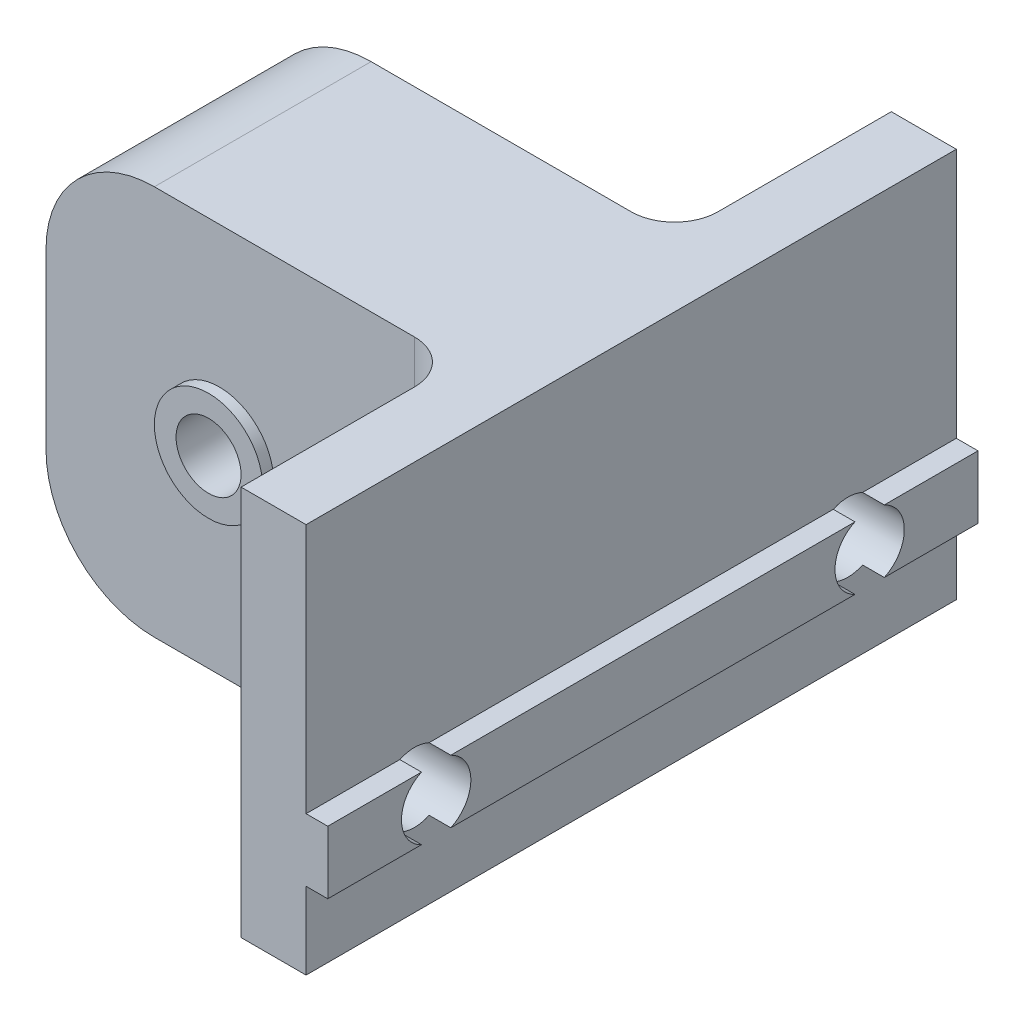
from build123d import *
from build123d.topology import SkipClean

# Parameters (mm, degrees)
MAIN_EXTRUSION_DEPTH            = 30
ESQUISSE2_W                     = 19
ESQUISSE2_H                     = 10
EXTERNAL_HOLE_DEPTH             = 37.986484018
ESQUISSE3_R                     = 1.6
MAKERBEAMFIXINGHOLE_DEPTH       = 38.815340802
ESQUISSE4_R                     = 1.5
HOLELINKWITHCODERSSUPPORT_DEPTH = 27.702059846
CONG_2_R                        = 2
CONG_3_R                        = 5
ESQUISSE6_R                     = 2.5
ESQUISSE6_R_2                   = 1.5
BOSS_EXTRU_1_DEPTH              = 0.5
BOSS_EXTRU_2_START              = 0.5
ESQUISSE7_R                     = 2.5
ESQUISSE7_R_2                   = 1.5
BOSS_EXTRU_2_DEPTH              = 0.5


with BuildPart() as part:
    # Esquisse1 → Main Extrusion (new body)
    with BuildSketch(Plane.XY):
        Polygon((-11, 13), (-11, -5), (11, -5), (11, -1.45), (12, -1.45), (12, 1.45), (11, 1.45), (11, 13), align=None)
    extrude(amount=MAIN_EXTRUSION_DEPTH)

    # Esquisse2 → External Hole (cut, through all)
    with BuildSketch(Plane(origin=(0, 13, 0), x_dir=(1, 0, 0), z_dir=(0, 1, 0))):
        with Locations((-1.5, -5)):
            Rectangle(ESQUISSE2_W, ESQUISSE2_H)
        with Locations((-1.5, -25)):
            Rectangle(ESQUISSE2_W, ESQUISSE2_H)
    extrude(amount=-EXTERNAL_HOLE_DEPTH, mode=Mode.SUBTRACT)

    # Esquisse3 → MakerBeamFixingHole (cut, through all)
    with BuildSketch(Plane.ZY.offset(-8)):
        with Locations((5, 0)):
            Circle(ESQUISSE3_R)
        with Locations((25, 0)):
            Circle(ESQUISSE3_R)
    extrude(amount=-MAKERBEAMFIXINGHOLE_DEPTH, mode=Mode.SUBTRACT)

    # Esquisse4 → HoleLinkWithCodersSupport (cut, through all)
    with BuildSketch(Plane.XY.offset(20)):
        with Locations((-3, 4)):
            Circle(ESQUISSE4_R)
    extrude(amount=-HOLELINKWITHCODERSSUPPORT_DEPTH, mode=Mode.SUBTRACT)

    # Congé2
    cong_2_edges = [part.edges().sort_by_distance(p)[0] for p in [
        (8, 4, 20),
        (8, 4, 10),
    ]]
    fillet(cong_2_edges, radius=CONG_2_R)

    # Congé3
    cong_3_edges = [part.edges().sort_by_distance(p)[0] for p in [
        (-11, -5, 15),
        (-11, 13, 15),
    ]]
    fillet(cong_3_edges, radius=CONG_3_R)

    # Esquisse6 → Boss.-Extru.1 (add)
    with SkipClean():  # the faces are left unmerged after this step: merging them gives an invalid solid
        with BuildSketch(Plane(origin=(0, 0, 10), x_dir=(-1, 0, 0), z_dir=(0, 0, -1))):
            with Locations((3, 4)):
                Circle(ESQUISSE6_R)
            with Locations((3, 4)):
                Circle(ESQUISSE6_R_2, mode=Mode.SUBTRACT)
        extrude(amount=BOSS_EXTRU_1_DEPTH)

    # Esquisse7 → Boss.-Extru.2 (add)
    with SkipClean():  # the faces are left unmerged after this step: merging them gives an invalid solid
        with BuildSketch(Plane.XY.offset(20).offset(BOSS_EXTRU_2_START)):
            with Locations((-3, 4)):
                Circle(ESQUISSE7_R)
            with Locations((-3, 4)):
                Circle(ESQUISSE7_R_2, mode=Mode.SUBTRACT)
        extrude(amount=-BOSS_EXTRU_2_DEPTH)


solid = part.part
